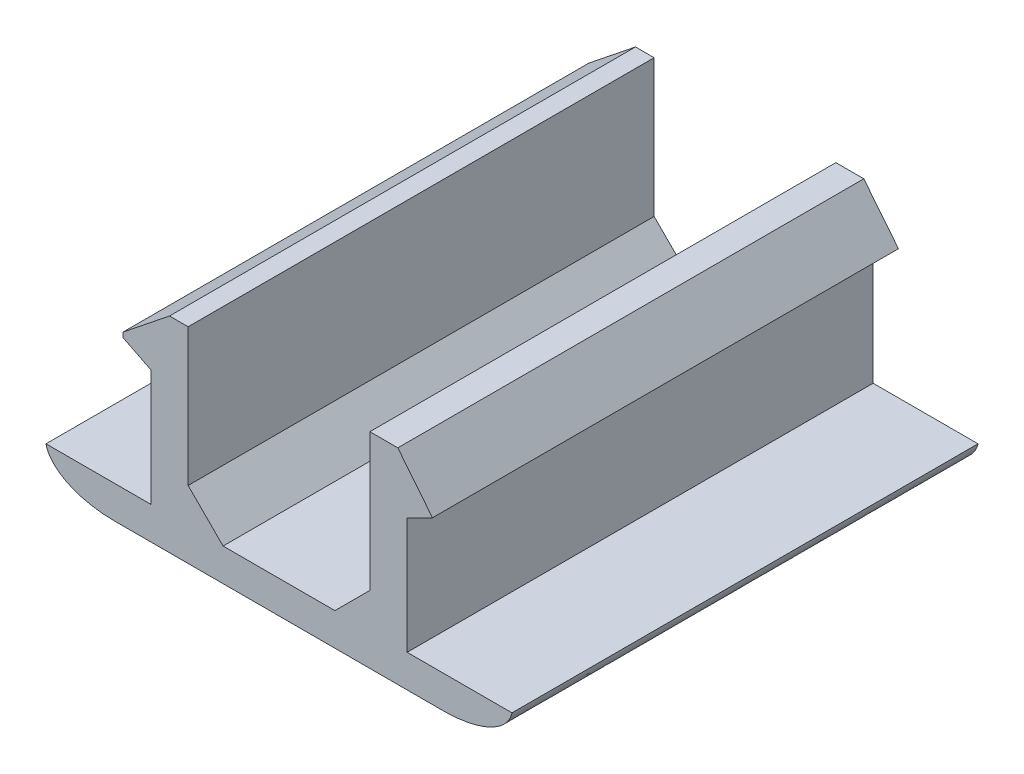
from build123d import *
from OCP.BRepFilletAPI import BRepFilletAPI_MakeChamfer

# Parameters (mm, degrees)
BOSS_EXTRUDE1_DEPTH = 10
FILLET1_START       = -1
FILLET1_DEPTH       = 12
FILLET2_SIZE        = 1
FILLET2_SIZE2       = 0.8
FILLET3_SIZE        = 0.3
FILLET3_SIZE_2      = 0.6
FILLET4_SIZE        = 0.75


with BuildPart() as part:
    # Sketch1 → Boss-Extrude1 (new body)
    with BuildSketch(Plane.XY):
        Polygon((0, 0), (0, 0.7), (2.25, 0.7), (2.25, 3.2), (1.65, 3.2), (1.65, 4.4), (3.05, 4.4), (3.05, 0.7), (6.95, 0.7), (6.95, 4.4), (8.35, 4.4), (8.35, 3.2), (7.75, 3.2), (7.75, 0.7), (10, 0.7), (10, 0), align=None)
    extrude(amount=BOSS_EXTRUDE1_DEPTH)

    # Fillet1: read off the stored shape, not the designer's step
    # Fillet1 outline → Fillet1 (cut)
    with BuildSketch(Plane.XY.offset(FILLET1_START)):
        with BuildLine():
            Line((0, 0), (1.469693846, 0))
            add(Edge.make_bspline(
                [(1.469693846, 0), (0.142886902, 0), (0, 0.7)],
                knots=[0, 0, 0, 1, 1, 1], degree=2, weights=[1, 0.774596669, 1]))
            Line((0, 0.7), (0, 0))
        make_face()
        with BuildLine():
            add(Edge.make_bspline(
                [(10, 0.7), (9.857113098, 0), (8.530306154, 0)],
                knots=[0, 0, 0, 1, 1, 1], degree=2, weights=[1, 0.774596669, 1]))
            Line((8.530306154, 0), (10, 0))
            Line((10, 0), (10, 0.7))
        make_face()
    extrude(amount=FILLET1_DEPTH, mode=Mode.SUBTRACT)

    # Fillet2: one chamfer whose edges measure the first distance from different faces: ONE call of the kernel's chamfer builder (chamfer() names one face for all edges)
    fillet2_edges_1 = [part.edges().sort_by_distance(p)[0] for p in [
        (1.65, 4.4, 5),
    ]]
    fillet2_side_1 = [part.faces().sort_by_distance(p)[0] for p in [
        (2.35, 4.4, 5),
    ]]
    fillet2_edges_2 = [part.edges().sort_by_distance(p)[0] for p in [
        (8.35, 4.4, 5),
    ]]
    fillet2_side_2 = [part.faces().sort_by_distance(p)[0] for p in [
        (8.35, 3.8, 5),
    ]]
    fillet2 = BRepFilletAPI_MakeChamfer(part.part.solid().wrapped)
    for e in fillet2_edges_1:
        fillet2.Add(FILLET2_SIZE, FILLET2_SIZE2, e.wrapped, fillet2_side_1[0].wrapped)  # the first distance lies on this face
    for e in fillet2_edges_2:
        fillet2.Add(FILLET2_SIZE, FILLET2_SIZE2, e.wrapped, fillet2_side_2[0].wrapped)  # the first distance lies on this face
    add(Compound.cast(fillet2.Shape()), mode=Mode.REPLACE)

    # Fillet3
    # the kernel refuses this chamfer: 0.6, 0.3 mm, written as the material it takes off along each edge
    with BuildSketch(Plane(origin=(1.65, 3.2, -1.553897324), x_dir=(0, 1, 0), z_dir=(0, 0, 1))) as fillet3_piece_1_section:
        Polygon((FILLET3_SIZE, 0), (0, -FILLET3_SIZE_2), (0, 0), align=None)
    fillet3_piece_1 = extrude(amount=13.107794649, mode=Mode.PRIVATE)
    fillet3_piece_1 = split(fillet3_piece_1, bisect_by=Plane(origin=(2.25, 3.2, -1.553897324), z_dir=(-1, 0, 0)), keep=Keep.TOP, mode=Mode.PRIVATE)
    add(fillet3_piece_1, mode=Mode.SUBTRACT)
    with BuildSketch(Plane(origin=(8.35, 3.2, -1.553897324), x_dir=(0, 1, 0), z_dir=(0, 0, 1))) as fillet3_piece_2_section:
        Polygon((FILLET3_SIZE, 0), (0, FILLET3_SIZE_2), (0, 0), align=None)
    fillet3_piece_2 = extrude(amount=13.107794649, mode=Mode.PRIVATE)
    fillet3_piece_2 = split(fillet3_piece_2, bisect_by=Plane(origin=(7.75, 3.2, -1.553897324), z_dir=(1, 0, 0)), keep=Keep.TOP, mode=Mode.PRIVATE)
    add(fillet3_piece_2, mode=Mode.SUBTRACT)

    # Fillet4
    fillet4_edges = [part.edges().sort_by_distance(p)[0] for p in [
        (3.05, 0.7, 5),
        (6.95, 0.7, 5),
    ]]
    chamfer(fillet4_edges, length=FILLET4_SIZE)


solid = part.part
